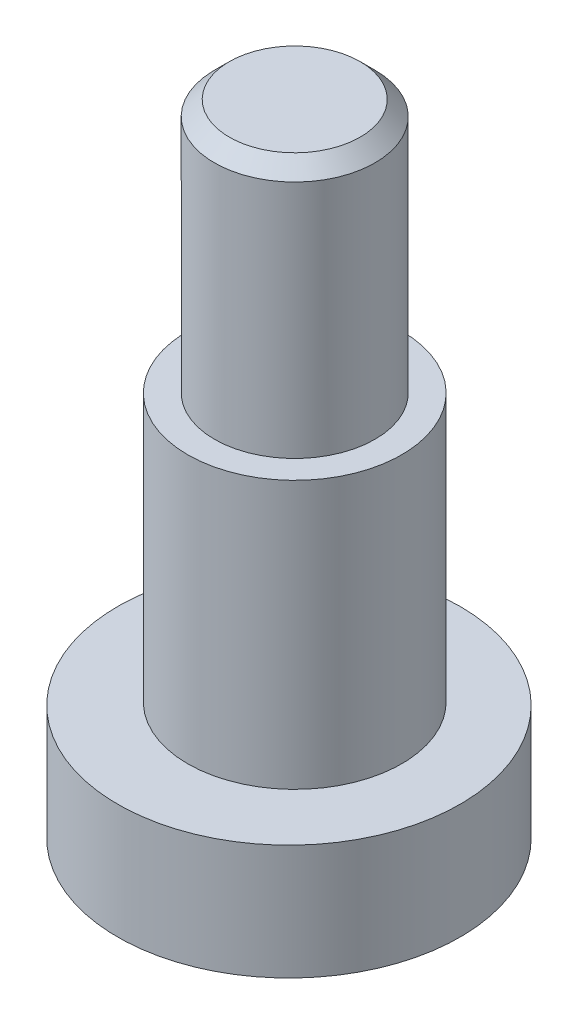
from build123d import *

# Parameters (mm, degrees)
SKETCH_1_R          = 6.4
EXTRUDE_1_DEPTH     = 4.3
SKETCH_2_R          = 4
EXTRUDE_2_DEPTH     = 10
SKETCH_3_R          = 3
EXTRUDE_3_DEPTH     = 9.5
CUT_EXTRUDE_1_DEPTH = 2


# Read off the part's stored shape, not the designer's step: M6x1.0 机械螺纹 螺柱1
with BuildPart() as part:
    # 草图1 → 凸台-拉伸1 (new body)
    with BuildSketch(Plane(origin=(0, 0, 0), x_dir=(1, 0, 0), z_dir=(0, 1, 0))):
        with Locations(Location((0, -0.216468968, 0), (0, 0, 90))):
            Circle(SKETCH_1_R)
    extrude(amount=EXTRUDE_1_DEPTH)

    # 草图2 → 凸台-拉伸2 (add)
    with BuildSketch(Plane(origin=(0, 4.3, 0), x_dir=(1, 0, 0), z_dir=(0, 1, 0))):
        with Locations(Location((0, 0, 0), (0, 0, 270))):
            Circle(SKETCH_2_R)
    extrude(amount=EXTRUDE_2_DEPTH)

    # 草图3 → 凸台-拉伸3 (add)
    with BuildSketch(Plane(origin=(0, 14.3, 0), x_dir=(1, 0, 0), z_dir=(0, 1, 0))):
        with Locations(Location((0, 0, 0), (0, 0, 270))):
            Circle(SKETCH_3_R)
    extrude(amount=EXTRUDE_3_DEPTH)

    # M6x1.0 机械螺纹 螺柱1 outline → M6x1.0 机械螺纹 螺柱1 (revolve, cut)
    with BuildSketch(Plane.XY):
        Polygon((3, 23.8), (2.4455, 23.8), (3, 23.2455), align=None)
    revolve(axis=Axis((0, 0, 0), (0, 1, 0)), mode=Mode.SUBTRACT)

    # 草图5 → 切除-拉伸1 (cut)
    with BuildSketch(Plane.XZ):
        Polygon((1.847520861, 0), (0.923760431, 1.6), (-0.923760431, 1.6), (-1.847520861, 0), (-0.923760431, -1.6), (0.923760431, -1.6), align=None)
    extrude(amount=-CUT_EXTRUDE_1_DEPTH, mode=Mode.SUBTRACT)


solid = part.part
